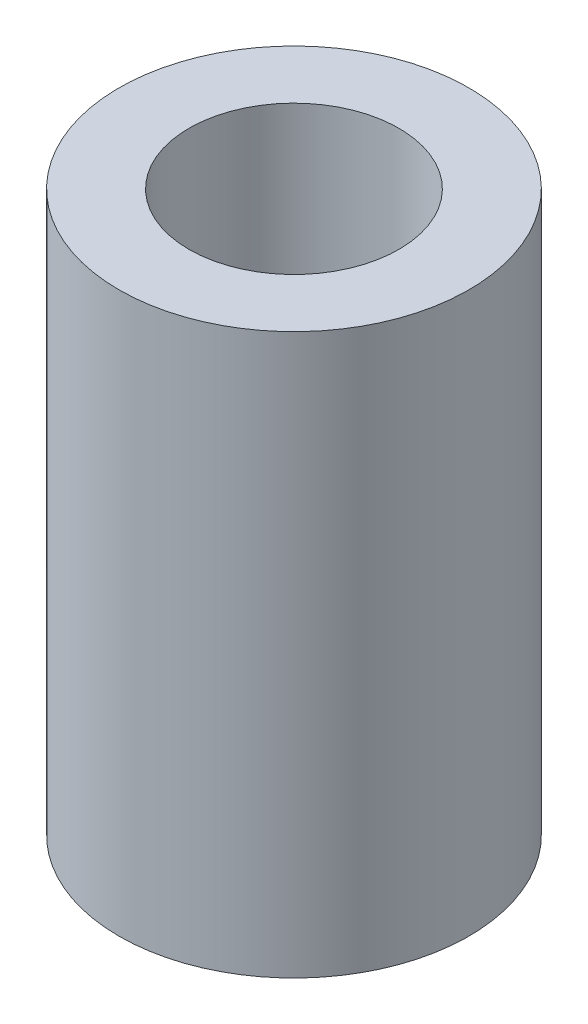
from build123d import *

# Parameters (mm, degrees)
SKETCH2_R           = 2.5
BOSS_EXTRUDE1_DEPTH = 8
SKETCH3_R           = 1.5
CUT_EXTRUDE1_DEPTH  = 6


with BuildPart() as part:
    # Sketch2 → Boss-Extrude1 (new body)
    with BuildSketch(Plane(origin=(0, 0, 0), x_dir=(1, 0, 0), z_dir=(0, 1, 0))):
        Circle(SKETCH2_R)
    extrude(amount=BOSS_EXTRUDE1_DEPTH)

    # Sketch3 → Cut-Extrude1 (cut)
    with BuildSketch(Plane(origin=(0, 8, 0), x_dir=(1, 0, 0), z_dir=(0, 1, 0))):
        Circle(SKETCH3_R)
    extrude(amount=-CUT_EXTRUDE1_DEPTH, mode=Mode.SUBTRACT)


solid = part.part
